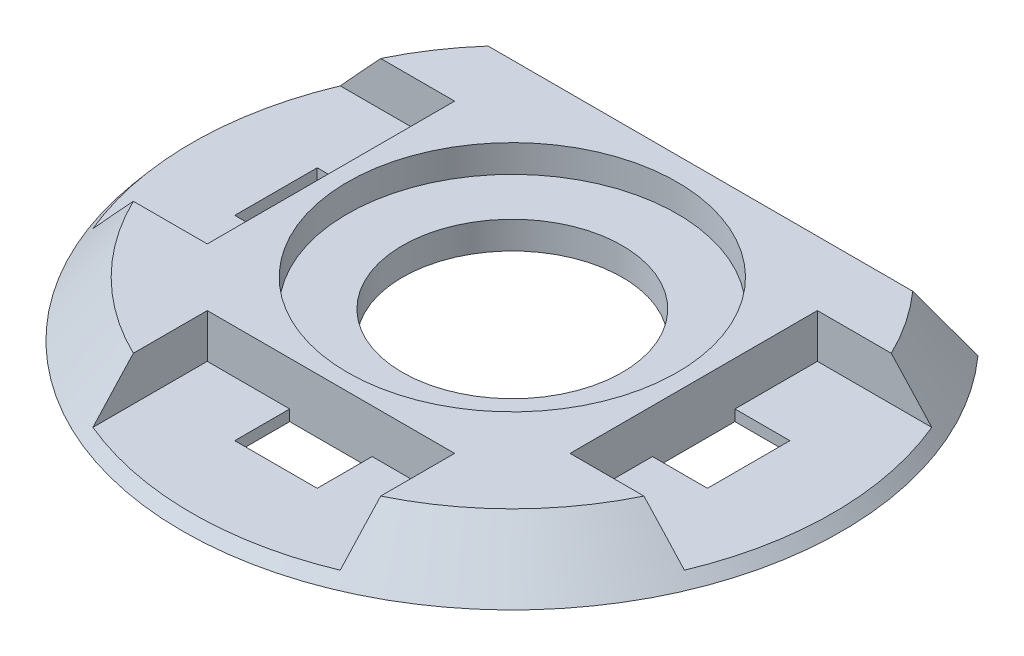
from build123d import *

# Parameters (mm, degrees)
SKETCH1_R           = 60
BOSS_EXTRUDE1_DEPTH = 10
BOSS_EXTRUDE1_TAPER = 40
SKETCH2_W           = 102.123847816
SKETCH2_H           = 48.488569787
CUT_EXTRUDE1_DEPTH  = 86.440037605
CHAMFER1_SIZE2      = 5.773502692
CHAMFER1_SIZE       = 10
SKETCH3_R           = 20
CUT_EXTRUDE2_DEPTH  = 86.440037453
SKETCH4_W           = 35.035611717
SKETCH4_H           = 45
CUT_EXTRUDE3_DEPTH  = 8
SKETCH6_W           = 10
SKETCH6_H           = 15
CUT_EXTRUDE5_DEPTH  = 86.229103011
CIRPATTERN1_COUNT   = 3
CIRPATTERN1_ANGLE   = 180
SKETCH7_R           = 30
CUT_EXTRUDE6_DEPTH  = 5


with BuildPart() as part:
    # Sketch1 → Boss-Extrude1 (new body)
    with BuildSketch(Plane(origin=(0, 0, 0), x_dir=(1, 0, 0), z_dir=(0, 1, 0))):
        Circle(SKETCH1_R)
    extrude(amount=BOSS_EXTRUDE1_DEPTH, taper=BOSS_EXTRUDE1_TAPER)

    # Sketch2 → Cut-Extrude1 (cut, through all)
    with BuildSketch(Plane(origin=(0, 10, 0), x_dir=(1, 0, 0), z_dir=(0, 1, 0))):
        with Locations((-1.760755997, 64.244284894)):
            Rectangle(SKETCH2_W, SKETCH2_H)
    extrude(amount=-CUT_EXTRUDE1_DEPTH, mode=Mode.SUBTRACT)

    # Chamfer1
    chamfer1_edges = [part.edges().sort_by_distance(p)[0] for p in [
        (0, 10, -40),
    ]]
    chamfer1_side = [part.faces().sort_by_distance(p)[0] for p in [
        (0, 9.884529946, -40),
    ]]
    chamfer(chamfer1_edges, length=CHAMFER1_SIZE - 0.0001, length2=CHAMFER1_SIZE2 - 0.0001, reference=chamfer1_side[0])  # a hair under: the kernel refuses the full size

    # Sketch3 → Cut-Extrude2 (cut, through all)
    with BuildSketch(Plane(origin=(0, 10, 0), x_dir=(1, 0, 0), z_dir=(0, 1, 0))):
        with Locations(Location((0, 0, 0), (0, 0, 270))):
            Circle(SKETCH3_R)
    extrude(amount=-CUT_EXTRUDE2_DEPTH, mode=Mode.SUBTRACT)

    # Sketch4 → Cut-Extrude3 (cut)
    with BuildSketch(Plane(origin=(0, 10, 0), x_dir=(1, 0, 0), z_dir=(0, 1, 0))):
        with Locations((50.517805859, 0)):
            Rectangle(SKETCH4_W, SKETCH4_H)
    cut_extrude3 = extrude(amount=-CUT_EXTRUDE3_DEPTH, mode=Mode.SUBTRACT)

    # Sketch6 → Cut-Extrude5 (cut, through all)
    with BuildSketch(Plane(origin=(0, 2, 0), x_dir=(1, 0, 0), z_dir=(0, 1, 0))):
        with Locations((38, 0)):
            Rectangle(SKETCH6_W, SKETCH6_H)
    cut_extrude5 = extrude(amount=-CUT_EXTRUDE5_DEPTH, mode=Mode.SUBTRACT)

    # CirPattern1: Cut-Extrude3, Cut-Extrude5 ×3 about axis
    cirpattern1_axis = Axis((0, 0, 0), (0, -1, 0))
    add([cut_extrude3.rotate(cirpattern1_axis, i * CIRPATTERN1_ANGLE / (CIRPATTERN1_COUNT - 1)) for i in range(1, CIRPATTERN1_COUNT)], mode=Mode.SUBTRACT)
    add([cut_extrude5.rotate(cirpattern1_axis, i * CIRPATTERN1_ANGLE / (CIRPATTERN1_COUNT - 1)) for i in range(1, CIRPATTERN1_COUNT)], mode=Mode.SUBTRACT)

    # Sketch7 → Cut-Extrude6 (cut)
    with BuildSketch(Plane(origin=(0, 10, 0), x_dir=(1, 0, 0), z_dir=(0, 1, 0))):
        with Locations(Location((0, 0, 0), (0, 0, 270))):
            Circle(SKETCH7_R)
    extrude(amount=-CUT_EXTRUDE6_DEPTH, mode=Mode.SUBTRACT)


solid = part.part
